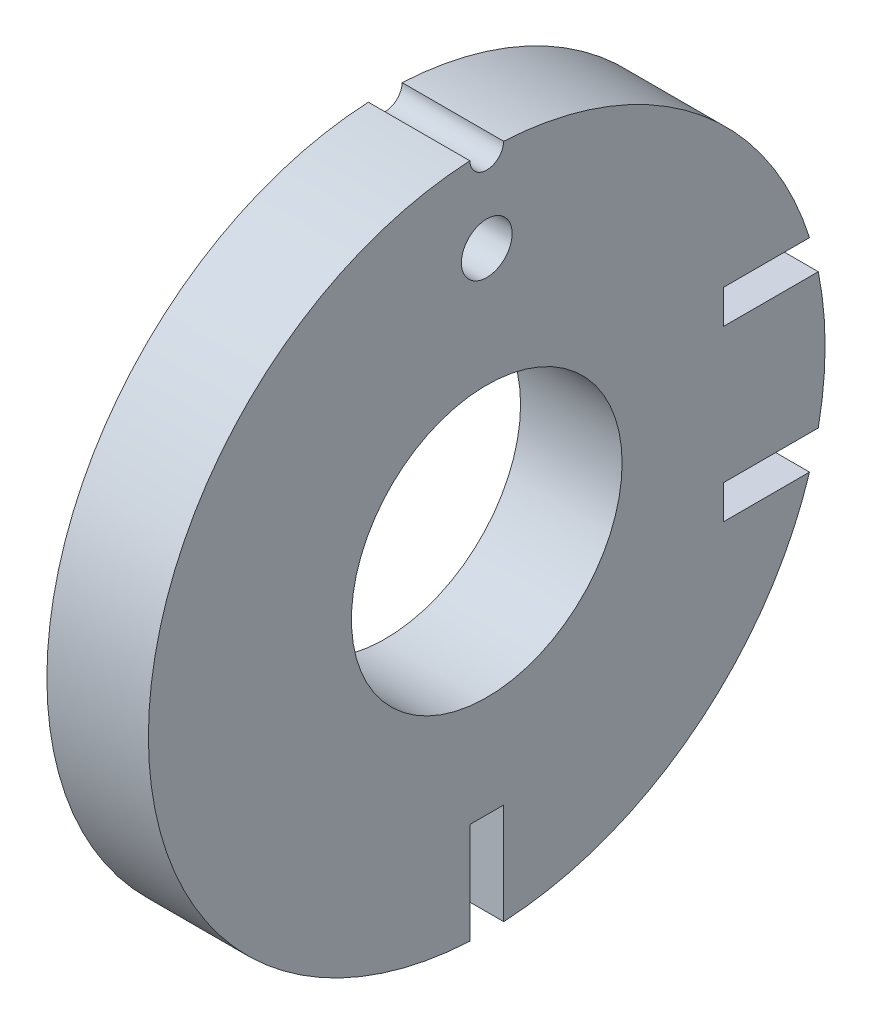
from build123d import *

# Parameters (mm, degrees)
SKETCH1_R           = 10
SKETCH1_R_2         = 4
BOSS_EXTRUDE1_DEPTH = 3
SKETCH2_R           = 0.75
SKETCH2_R_2         = 0.5
SKETCH2_W           = 5.709686215
SKETCH2_H           = 1
SKETCH2_W_2         = 1
SKETCH2_H_2         = 4.505813393
CUT_EXTRUDE1_DEPTH  = 3


with BuildPart() as part:
    # Sketch1 → Boss-Extrude1 (new body)
    with BuildSketch(Plane(origin=(0, 0, 0), x_dir=(0, 0, -1), z_dir=(1, 0, 0))):
        Circle(SKETCH1_R)
        Circle(SKETCH1_R_2, mode=Mode.SUBTRACT)
    extrude(amount=BOSS_EXTRUDE1_DEPTH)

    # Sketch2 → Cut-Extrude1 (cut)
    with BuildSketch(Plane(origin=(3, 0, 0), x_dir=(0, 0, -1), z_dir=(1, 0, 0))):
        with Locations((0, 7.5)):
            Circle(SKETCH2_R)
        with Locations((0, 10)):
            Circle(SKETCH2_R_2)
        with Locations((9.854843108, 2.5)):
            Rectangle(SKETCH2_W, SKETCH2_H)
        with Locations((9.854843108, -2.5)):
            Rectangle(SKETCH2_W, SKETCH2_H)
        with Locations((0, -9.252906697)):
            Rectangle(SKETCH2_W_2, SKETCH2_H_2)
    extrude(amount=-CUT_EXTRUDE1_DEPTH, mode=Mode.SUBTRACT)


solid = part.part
